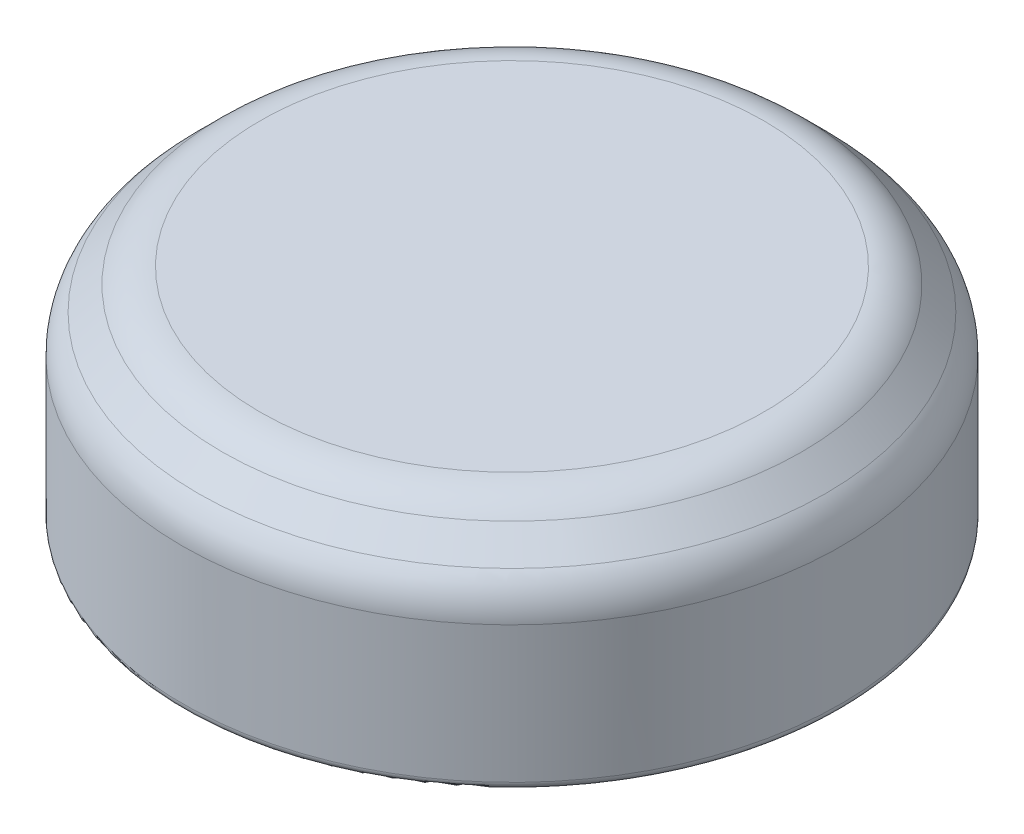
from build123d import *

# Parameters (mm, degrees)
SKETCH1_R           = 14.6431
BOSS_EXTRUDE1_DEPTH = 9.525
FILLET1_SIZE        = 2.032
SHELL1_T            = 1.016
SKETCH2_W           = 5.08
SKETCH2_H           = 3.048
CUT_EXTRUDE1_DEPTH  = 25.4
FILLET2_R           = 0.381
SNAP_START          = -15.1892
SNAP_GROOVE1_DEPTH  = 0.567483728
CIRPATTERN2_COUNT   = 4
FILLET3_R           = 2.54
FILLET4_R           = 2.54


# Read off the part's stored shape, not the designer's step: Snap Groove1
with BuildPart() as part:
    # Sketch1 → Boss-Extrude1 (new body)
    with BuildSketch(Plane(origin=(0, 0, 0), x_dir=(1, 0, 0), z_dir=(0, 1, 0))):
        with Locations(Location((0, 0, 0), (0, 0, 90))):
            Circle(SKETCH1_R)
    extrude(amount=BOSS_EXTRUDE1_DEPTH)

    # Fillet1
    fillet1_edges = [part.edges().sort_by_distance(p)[0] for p in [
        (0, 9.525, 14.6431),
    ]]
    chamfer(fillet1_edges, length=FILLET1_SIZE)

    # Shell1
    shell1_openings = [part.faces().sort_by_distance(p)[0] for p in [
        (0, 0, 0),
    ]]
    offset(amount=SHELL1_T, openings=shell1_openings, kind=Kind.INTERSECTION)

    # Sketch2 → Cut-Extrude1 (cut)
    with BuildSketch(Plane.XY):
        with Locations((0, 1.524)):
            Rectangle(SKETCH2_W, SKETCH2_H)
    extrude(amount=-CUT_EXTRUDE1_DEPTH, mode=Mode.SUBTRACT)

    # Fillet2
    fillet2_edges = [part.edges().sort_by_distance(p)[0] for p in [
        (0, 0, 15.6591),
    ]]
    fillet(fillet2_edges, radius=FILLET2_R)

    # Snap Groove1 outline → Snap Groove1 (cut)
    with BuildSketch(Plane(origin=(0, 0, 0), x_dir=(0.9711506345911166, 0, -0.23846686338623996), z_dir=(0.23846686338623993, 0, 0.9711506345911166)).offset(SNAP_START)):
        Polygon((-0.707206527, 5.6642), (-0.791069456, 4.064), (0.791069456, 4.064), (0.707206527, 5.6642), align=None)
    snap_groove1 = extrude(amount=SNAP_GROOVE1_DEPTH, mode=Mode.SUBTRACT)

    # CirPattern2: Snap Groove1 ×4 about axis
    cirpattern2_axis = Axis((0, 0, 0), (0, 1, 0))
    for i in range(1, CIRPATTERN2_COUNT):
        add(snap_groove1.rotate(cirpattern2_axis, i * 360 / CIRPATTERN2_COUNT), mode=Mode.SUBTRACT)

    # Fillet3
    fillet3_edges = [part.edges().sort_by_distance(p)[0] for p in [
        (0, 7.913840979, 15.6591),
    ]]
    fillet(fillet3_edges, radius=FILLET3_R)

    # Fillet4
    fillet4_edges = [part.edges().sort_by_distance(p)[0] for p in [
        (0, 10.541, 13.031940979),
    ]]
    fillet(fillet4_edges, radius=FILLET4_R)


solid = part.part
